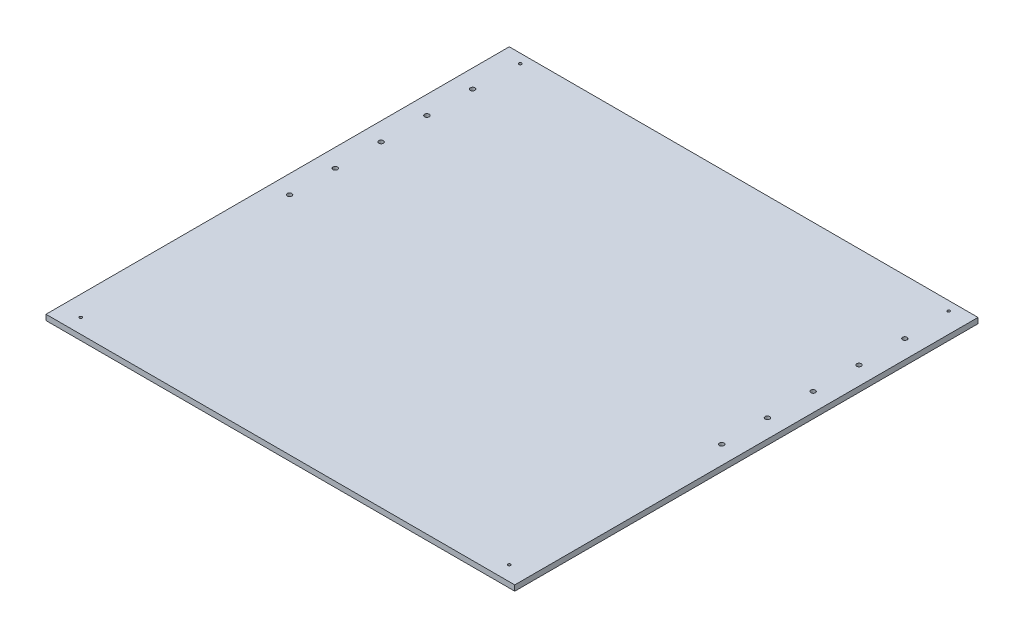
from build123d import *

# Parameters (mm, degrees)
SKETCH1_W           = 500
SKETCH1_H           = 500
SKETCH1_R           = 1.5
SKETCH1_R_2         = 1.525
BOSS_EXTRUDE1_DEPTH = 6
BOSS_EXTRUDE2_DEPTH = 6
SKETCH3_R           = 2.5
CUT_EXTRUDE1_DEPTH  = 716.617216115


with BuildPart() as part:
    # Sketch1 → Boss-Extrude1 (new body)
    with BuildSketch(Plane(origin=(0, 0, 0), x_dir=(1, 0, 0), z_dir=(0, 1, 0))):
        with Locations((250, -250)):
            Rectangle(SKETCH1_W, SKETCH1_H)
        with Locations((16, -10)):
            Circle(SKETCH1_R, mode=Mode.SUBTRACT)
        with Locations((484, -10)):
            Circle(SKETCH1_R, mode=Mode.SUBTRACT)
        with Locations((484, -490)):
            Circle(SKETCH1_R, mode=Mode.SUBTRACT)
        with Locations((16, -490)):
            Circle(SKETCH1_R_2, mode=Mode.SUBTRACT)
    extrude(amount=BOSS_EXTRUDE1_DEPTH)

    # Sketch2 → Boss-Extrude2 (add)
    with BuildSketch(Plane.XZ):
        Polygon((-6, 506), (-6, 0), (0, 0), (0, 500), (500, 500), (500, 0), (506, 0), (506, 506), align=None)
    extrude(amount=-BOSS_EXTRUDE2_DEPTH)

    # Sketch3 → Cut-Extrude1 (cut, through all)
    with BuildSketch(Plane.XZ):
        with Locations((14, 60)):
            Circle(SKETCH3_R)
        with Locations((14, 110)):
            Circle(SKETCH3_R)
        with Locations((14, 160)):
            Circle(SKETCH3_R)
        with Locations((14, 210)):
            Circle(SKETCH3_R)
        with Locations((14, 260)):
            Circle(SKETCH3_R)
        with Locations((486, 60)):
            Circle(SKETCH3_R)
        with Locations((486, 110)):
            Circle(SKETCH3_R)
        with Locations((486, 160)):
            Circle(SKETCH3_R)
        with Locations((486, 210)):
            Circle(SKETCH3_R)
        with Locations((486, 260)):
            Circle(SKETCH3_R)
    extrude(amount=-CUT_EXTRUDE1_DEPTH, mode=Mode.SUBTRACT)


solid = part.part
